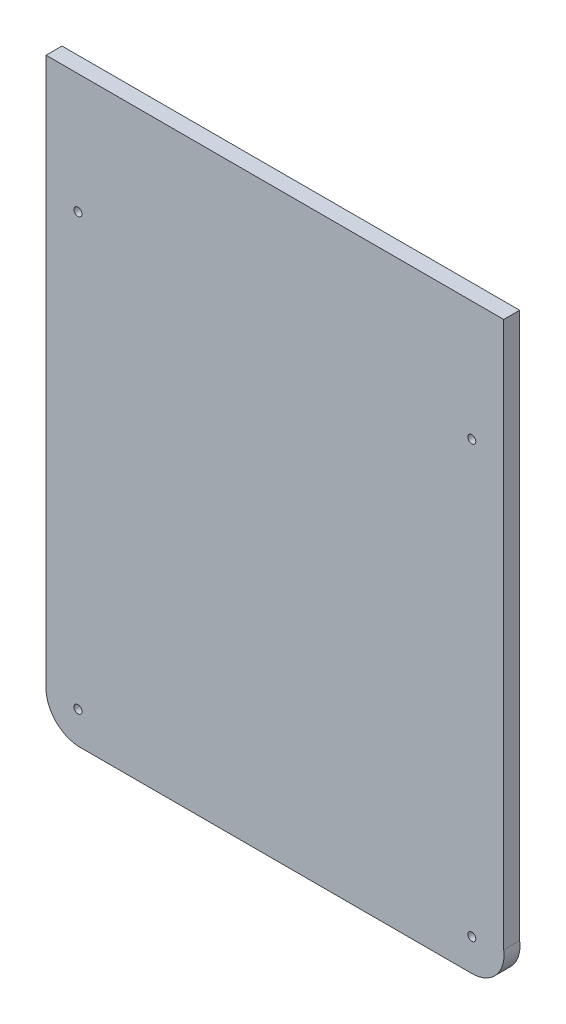
from build123d import *

# Parameters (mm, degrees)
BOSS_EXTRUDE1_DEPTH = 6.35
HOLE1_D             = 3.175
HOLE1_DEPTH         = 31.75
HOLE1_CSINK_D       = 10.16
HOLE1_CSINK_ANGLE   = 82
HOLE1_TIP           = 0.953866233


with BuildPart() as part:
    # Sketch1 → Boss-Extrude1 (new body)
    with BuildSketch(Plane.XY):
        with BuildLine():
            Line((-19.05, 920.17470301), (163.099999994, 920.17470301))
            Line((163.099999994, 920.17470301), (163.099999994, 702.843692969))
            ThreePointArc((163.099999994, 702.843692969), (160.057961653, 692.7131448), (150.399999994, 688.39970301))
            Line((150.399999994, 688.39970301), (-6.35, 688.39970301))
            ThreePointArc((-6.35, 688.39970301), (-15.057025907, 692.392677103), (-19.05, 701.09970301))
            Line((-19.05, 701.09970301), (-19.05, 920.17470301))
        make_face()
    extrude(amount=BOSS_EXTRUDE1_DEPTH)

    # Hole1
    with Locations(Plane(origin=(72.024999997, -420.489492837, 19.05), x_dir=(1, 0, 0), z_dir=(0, 0, 1))):
        with Locations((-78.374999997, 1293.039195846), (-78.374999997, 1121.589195846), (78.374999997, 1121.589195846), (78.374999997, 1293.039195846), (-764.015524801, 1530.078195669)):
            CounterSinkHole(HOLE1_D / 2, HOLE1_CSINK_D / 2, depth=HOLE1_DEPTH, counter_sink_angle=HOLE1_CSINK_ANGLE)
            with Locations((0, 0, -(HOLE1_DEPTH + HOLE1_TIP / 2))):  # 118° drill point
                Cone(0, HOLE1_D / 2, HOLE1_TIP, mode=Mode.SUBTRACT)


solid = part.part
